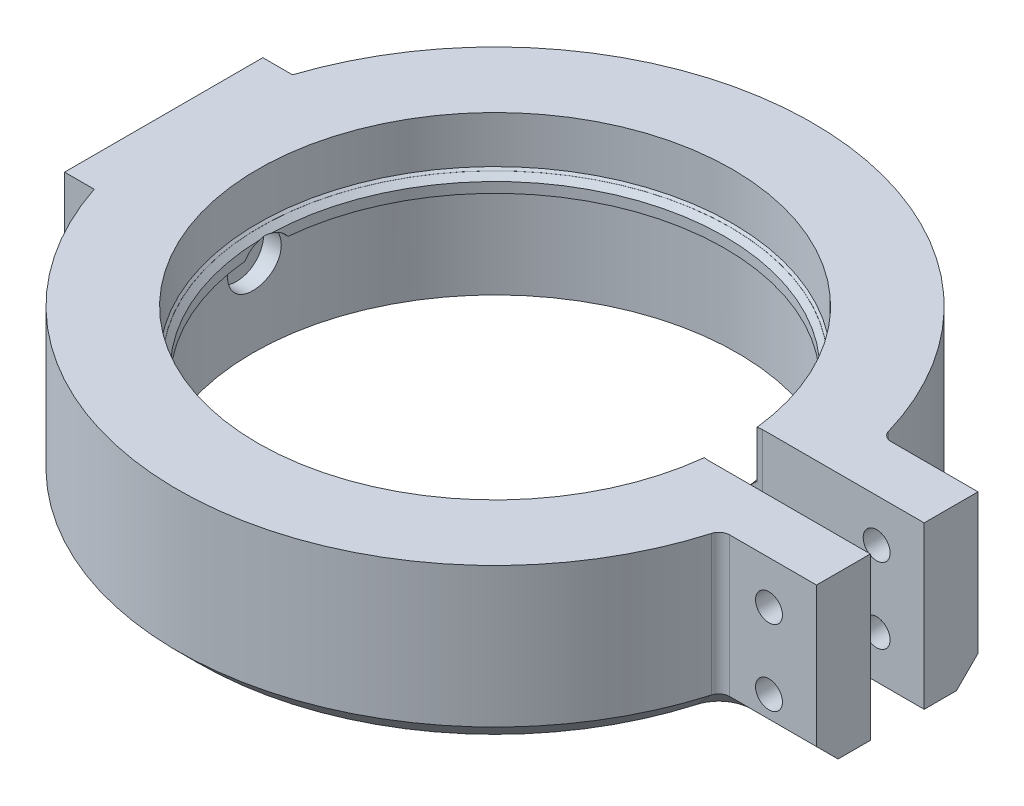
from build123d import *

# Parameters (mm, degrees)
BOSS_EXTRUDE1_DEPTH = 15
REVOLVE2_ANGLE      = 347.2
SKETCH9_R           = 1.25
CUT_EXTRUDE1_DEPTH  = 20
SKETCH10_R          = 2.475
CUT_EXTRUDE3_DEPTH  = 4
SKETCH12_R          = 1
CUT_EXTRUDE4_DEPTH  = 5
SKETCH13_R          = 2.5
CUT_EXTRUDE6_DEPTH  = 24
CHAMFER1_SIZE       = 0.2
FILLET1_R           = 1
CHAMFER2_SIZE       = 0.5
CHAMFER3_SIZE       = 2


with BuildPart() as part:
    # Sketch3 → Boss-Extrude1 (new body)
    with BuildSketch(Plane(origin=(0, 0, 0), x_dir=(1, 0, 0), z_dir=(0, 1, 0))):
        with BuildLine():
            Line((22.360679775, 2.5), (37.360679775, 2.5))
            Line((37.360679775, 2.5), (37.360679775, 7.5))
            Line((37.360679775, 7.5), (28.530685235, 7.5))
            ThreePointArc((28.530685235, 7.5), (0.890802954, 29.486547273), (-28.025910222, 9.208602294))
            Line((-28.025910222, 9.208602294), (-30.781929629, 9.208602294))
            Line((-30.781929629, 9.208602294), (-30.781929629, -9.208602294))
            Line((-30.781929629, -9.208602294), (-28.025910222, -9.208602294))
            ThreePointArc((-28.025910222, -9.208602294), (0.890802954, -29.486547273), (28.530685235, -7.5))
            Line((28.530685235, -7.5), (37.360679775, -7.5))
            Line((37.360679775, -7.5), (37.360679775, -2.5))
            Line((37.360679775, -2.5), (22.360679775, -2.5))
            ThreePointArc((22.360679775, -2.5), (-22.5, 0), (22.360679775, 2.5))
        make_face()
    extrude(amount=BOSS_EXTRUDE1_DEPTH)

    # Sketch8 → Revolve2 (revolve)
    with BuildSketch(Plane(origin=(0, 0, 0), x_dir=(-0.9938079899999066, 0, 0.11111111111111108), z_dir=(-0.11111111111111106, 0, -0.9938079899999065))):
        Polygon((-22.5, 9), (-21.33, 9), (-21.33, 10.45), (-22.04, 10.45), (-22.04, 15), (-22.5, 15), align=None)
    revolve(axis=Axis((0, 0, 0), (0, 1, 0)), revolution_arc=REVOLVE2_ANGLE)

    # Sketch9 → Cut-Extrude1 (cut)
    with BuildSketch(Plane.XY.offset(7.5)):
        with Locations((32.945682505, 11)):
            Circle(SKETCH9_R)
        with Locations((32.945682505, 4)):
            Circle(SKETCH9_R)
    extrude(amount=-CUT_EXTRUDE1_DEPTH, mode=Mode.SUBTRACT)

    # Sketch10 → Cut-Extrude3 (cut)
    with BuildSketch(Plane.ZY.offset(30.781929629)):
        with Locations((0, 7.5)):
            Circle(SKETCH10_R)
    extrude(amount=-CUT_EXTRUDE3_DEPTH, mode=Mode.SUBTRACT)

    # Sketch12 → Cut-Extrude4 (cut)
    with BuildSketch(Plane.ZY.offset(26.781929629)):
        with Locations((0, 7.5)):
            Circle(SKETCH12_R)
    extrude(amount=-CUT_EXTRUDE4_DEPTH, mode=Mode.SUBTRACT)

    # Sketch13 → Cut-Extrude6 (cut)
    with BuildSketch(Plane(origin=(0, 0, 0), x_dir=(0, 0, -1), z_dir=(1, 0, 0))):
        with Locations((0, 7.5)):
            Circle(SKETCH13_R)
    extrude(amount=-CUT_EXTRUDE6_DEPTH, mode=Mode.SUBTRACT)

    # Chamfer1
    chamfer1_edges = [part.edges().sort_by_distance(p)[0] for p in [
        (-0.259360391, 9, 22.49850511),
        (-22.039998571, 10.45, -0.007935673),
    ]]
    chamfer(chamfer1_edges, length=CHAMFER1_SIZE)

    # Fillet1
    fillet1_edges = [part.edges().sort_by_distance(p)[0] for p in [
        (28.530685235, 7.5, 7.5),
        (28.530685235, 7.5, -7.5),
    ]]
    fillet(fillet1_edges, radius=FILLET1_R)

    # Chamfer2
    # the kernel refuses this chamfer: 0.5 mm, written as the material it takes off along each edge
    with BuildSketch(Plane(origin=(0, 10.45, 0), x_dir=(0.9987152347198149, 0, -0.05067425321151771), z_dir=(0.05067425321151771, 0, 0.9987152347198149))) as chamfer2_piece_1:
        Polygon((21.33, -CHAMFER2_SIZE), (21.33 + CHAMFER2_SIZE, 0), (21.33, 0), align=None)
    revolve(axis=Axis((0, 10.45, 0), (0, 1, 0)), revolution_arc=354.149410651, mode=Mode.SUBTRACT)

    # Chamfer3
    chamfer3_edges = [part.edges().sort_by_distance(p)[0] for p in [
        (0.516715321, 0, -29.495474319),
        (33.326158403, 0, 7.5),
        (28.691090832, 0, -7.700409941),
        (28.691090832, 0, 7.700409941),
        (0.516715321, 0, 29.495474319),
        (33.326158403, 0, -7.5),
    ]]
    chamfer(chamfer3_edges, length=CHAMFER3_SIZE)


solid = part.part
